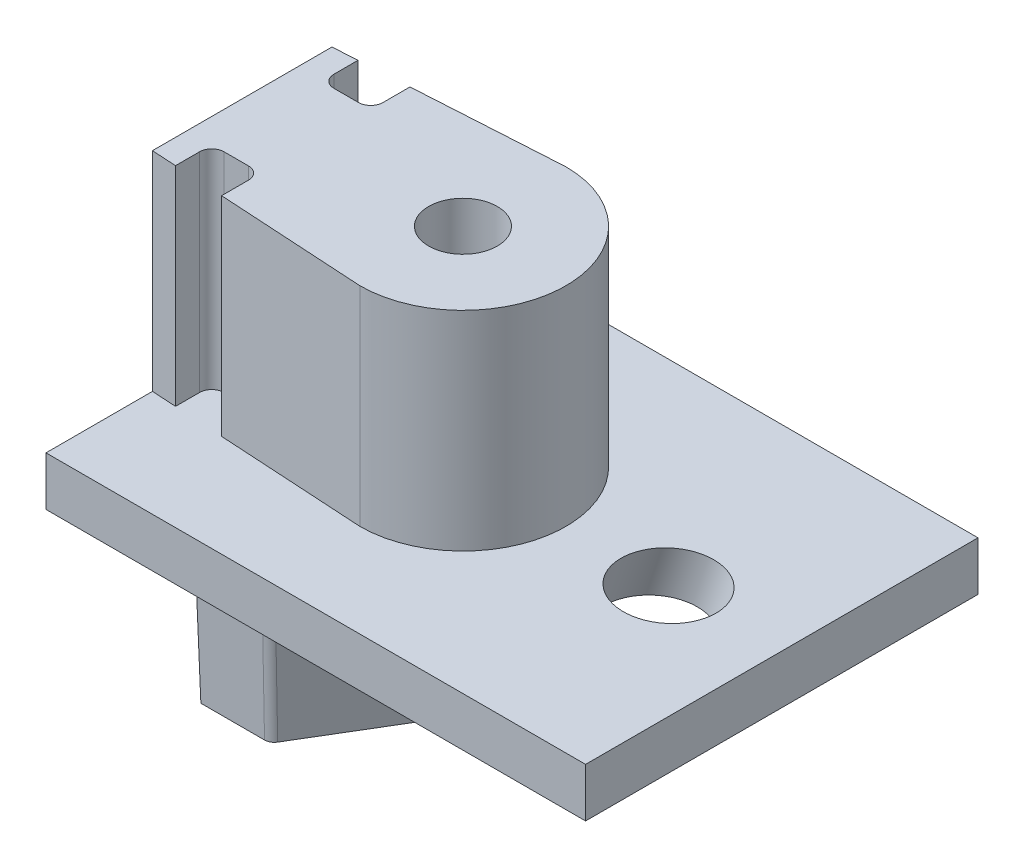
from build123d import *

# Parameters (mm, degrees)
BOSS_EXTRUDE1_DEPTH     = 2.125
SKETCH4_R               = 0.35
THROUGH_HOLES_DEPTH     = 4.445014514
FILLET1_R               = 0.125
SKETCH5_R               = 0.125
BOSS_EXTRUDE2_DEPTH     = 0.5
SKETCH8_R               = 0.46
CUT_EXTRUDE1_DEPTH      = 5.582575695
CUT_EXTRUDE2_DEPTH      = 5.367851302
CUT_EXTRUDE2_DEPTH_BACK = 5.367851302
SKETCH9_W               = 1.465031661
SKETCH9_H               = 4
BOSS_EXTRUDE3_DEPTH     = 1.75
CHAMFER1_SIZE           = 1.8
CHAMFER1_SIZE_2         = 0.078589697
FILLET2_R               = 0.1


with BuildPart() as part:
    # Sketch3 → Boss-Extrude1 (new body)
    with BuildSketch(Plane(origin=(0, 0, 0), x_dir=(1, 0, 0), z_dir=(0, 1, 0))):
        with BuildLine():
            Line((-2.5, 0.9), (-2, 0.93))
            Line((-2, 0.93), (-2, 0.56))
            Line((-2, 0.56), (-1.5, 0.56))
            Line((-1.5, 0.56), (-1.5, 0.96))
            Line((-1.5, 0.96), (0, 1.05))
            ThreePointArc((0, 1.05), (1.05, 0), (0, -1.05))
            Line((0, -1.05), (-1.5, -0.96))
            Line((-1.5, -0.96), (-1.5, -0.56))
            Line((-1.5, -0.56), (-2, -0.56))
            Line((-2, -0.56), (-2, -0.93))
            Line((-2, -0.93), (-2.5, -0.9))
            Line((-2.5, -0.9), (-2.5, 0.9))
        make_face()
    extrude(amount=BOSS_EXTRUDE1_DEPTH)

    # Sketch4 → Through Holes (cut, through all)
    with BuildSketch(Plane(origin=(0, 2.125, 0), x_dir=(1, 0, 0), z_dir=(0, 1, 0))):
        with Locations(Location((0, 0, 0), (0, 0, 270))):
            Circle(SKETCH4_R)
    extrude(amount=-THROUGH_HOLES_DEPTH, mode=Mode.SUBTRACT)

    # Fillet1
    fillet1_edges = [part.edges().sort_by_distance(p)[0] for p in [
        (-2, 1.0625, -0.56),
        (-1.5, 1.0625, -0.56),
        (-1.5, 1.0625, 0.56),
        (-2, 1.0625, 0.56),
    ]]
    fillet(fillet1_edges, radius=FILLET1_R)

    # Sketch5 → Boss-Extrude2 (add)
    with BuildSketch(Plane(origin=(0, 0, 0), x_dir=(1, 0, 0), z_dir=(0, 1, 0))):
        Polygon((-2.25, -2), (1.75, -2), (3.25, -2), (3.25, 2), (1.75, 2), (-2.25, 2), align=None)
        with Locations(Location((0, 0, 0), (0, 0, 270))):
            Circle(SKETCH5_R, mode=Mode.SUBTRACT)
    extrude(amount=-BOSS_EXTRUDE2_DEPTH)

    # Sketch8 → Cut-Extrude1 (cut, through all)
    with BuildSketch(Plane(origin=(0.7, 2.1, 0), x_dir=(0.948683298050514, -0.3162277660168378, 0), z_dir=(0.3162277660168378, 0.948683298050514, 0))):
        with Locations((1.987936011, 0)):
            Circle(SKETCH8_R)
    extrude(amount=-CUT_EXTRUDE1_DEPTH, mode=Mode.SUBTRACT)

    # Sketch9 → Cut-Extrude2 (cut, two sides: drawn at the far end of the back side and taken through both)
    with BuildSketch(Plane.XZ.offset(-CUT_EXTRUDE2_DEPTH_BACK)):
        with Locations((-2.982515831, 0)):
            Rectangle(SKETCH9_W, SKETCH9_H)
    extrude(amount=CUT_EXTRUDE2_DEPTH + CUT_EXTRUDE2_DEPTH_BACK, mode=Mode.SUBTRACT)

    # Sketch10 → Boss-Extrude3 (add)
    with BuildSketch(Plane.XZ.offset(0.5)):
        Polygon((-1.5, 1.25), (-1.5, -1.25), (-0.75, -1.25), (0, 0), (-0.75, 1.25), align=None)
    extrude(amount=BOSS_EXTRUDE3_DEPTH)

    # Chamfer1
    # the kernel refuses this chamfer: 1.8, 0.078589697 mm, written as the material it takes off along each edge
    with BuildSketch(Plane(origin=(-6.179835266, -2.25, -1.25), x_dir=(0, 0.999998592613724, -0.0016777278000430623), z_dir=(1, 0, 0))) as chamfer1_piece_1_section:
        Polygon((CHAMFER1_SIZE * 0.999998592614, CHAMFER1_SIZE * 0.00167772780004), (-CHAMFER1_SIZE_2 * 0.00167772780507, CHAMFER1_SIZE_2 * 0.999998595608), (0, 0), align=None)
    chamfer1_piece_1 = extrude(amount=10.109670532, mode=Mode.PRIVATE)
    chamfer1_piece_1 = split(chamfer1_piece_1, bisect_by=Plane(origin=(-1.125, -0.5, -1.243941513), z_dir=(0, -1, 0)), keep=Keep.TOP, mode=Mode.PRIVATE)
    add(chamfer1_piece_1, mode=Mode.SUBTRACT)
    with BuildSketch(Plane(origin=(-3.157755381, -2.25, -5.262925634), x_dir=(0.0014386397198082417, 0.9999985926137243, -0.0008631838318849449), z_dir=(0.5144957554275265, 0, 0.8574929257125442))) as chamfer1_piece_2_section:
        Polygon((CHAMFER1_SIZE * 0.999998592614, CHAMFER1_SIZE * 0.00167772780004), (-CHAMFER1_SIZE_2 * 0.00167772780507, CHAMFER1_SIZE_2 * 0.999998595608), (0, 0), align=None)
    chamfer1_piece_2 = extrude(amount=10.817408506, mode=Mode.PRIVATE)
    chamfer1_piece_2 = split(chamfer1_piece_2, bisect_by=Plane(origin=(-0.38019511, -0.5, -0.621882934), z_dir=(0, -1, 0)), keep=Keep.TOP, mode=Mode.PRIVATE)
    add(chamfer1_piece_2, mode=Mode.SUBTRACT)
    with BuildSketch(Plane(origin=(2.407755381, -2.25, -4.012925634), x_dir=(0.0014386397198082065, 0.9999985926137243, 0.0008631838318849242), z_dir=(-0.5144957554275267, 0, 0.8574929257125442))) as chamfer1_piece_3_section:
        Polygon((CHAMFER1_SIZE * 0.999998592614, CHAMFER1_SIZE * 0.00167772780004), (-CHAMFER1_SIZE_2 * 0.00167772780507, CHAMFER1_SIZE_2 * 0.999998595608), (0, 0), align=None)
    chamfer1_piece_3 = extrude(amount=10.817408506, mode=Mode.PRIVATE)
    chamfer1_piece_3 = split(chamfer1_piece_3, bisect_by=Plane(origin=(-0.38019511, -0.5, 0.621882934), z_dir=(0, -1, 0)), keep=Keep.TOP, mode=Mode.PRIVATE)
    add(chamfer1_piece_3, mode=Mode.SUBTRACT)
    with BuildSketch(Plane(origin=(3.929835266, -2.25, 1.25), x_dir=(0, 0.999998592613724, 0.0016777278000430623), z_dir=(-1, 0, 0))) as chamfer1_piece_4_section:
        Polygon((CHAMFER1_SIZE * 0.999998592614, CHAMFER1_SIZE * 0.00167772780004), (-CHAMFER1_SIZE_2 * 0.00167772780507, CHAMFER1_SIZE_2 * 0.999998595608), (0, 0), align=None)
    chamfer1_piece_4 = extrude(amount=10.109670532, mode=Mode.PRIVATE)
    chamfer1_piece_4 = split(chamfer1_piece_4, bisect_by=Plane(origin=(-1.125, -0.5, 1.243941513), z_dir=(0, -1, 0)), keep=Keep.TOP, mode=Mode.PRIVATE)
    add(chamfer1_piece_4, mode=Mode.SUBTRACT)

    # Fillet2
    fillet2_edges = [part.edges().sort_by_distance(p)[0] for p in [
        (-0.772866375, -1.375, 1.209613628),
        (-0.772866375, -1.375, -1.209613628),
    ]]
    fillet(fillet2_edges, radius=FILLET2_R)


solid = part.part
